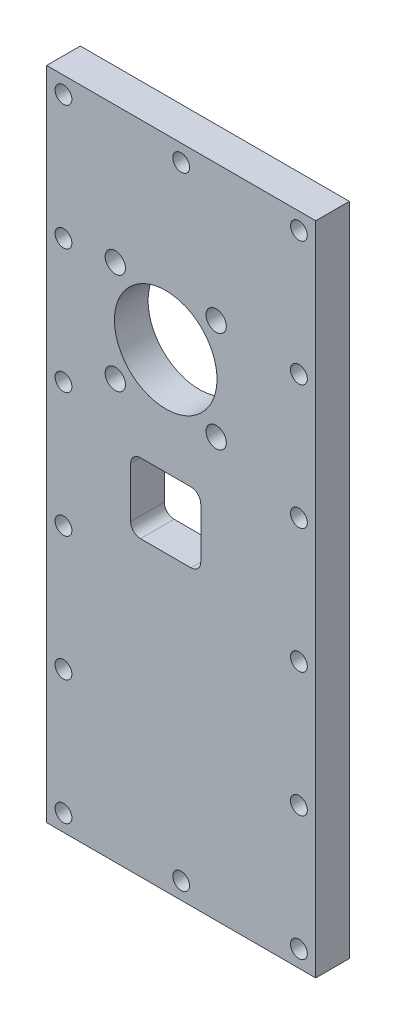
from build123d import *

# Parameters (mm, degrees)
SKIZZE1_W                       = 80
SKIZZE1_H                       = 195
AUFSATZ_LINEAR_AUSTRAGEN1_DEPTH = 10
SKIZZE2_R                       = 3.015
SKIZZE2_R_2                     = 15.25
SCHNITT_LINEAR_AUSTRAGEN1_DEPTH = 10
SKIZZE3_R                       = 1.25
SCHNITT_LINEAR_AUSTRAGEN2_DEPTH = 5
SKIZZE4_R                       = 2.5
SCHNITT_LINEAR_AUSTRAGEN3_DEPTH = 5


with BuildPart() as part:
    # Skizze1 → Aufsatz-Linear austragen1 (new body)
    with BuildSketch(Plane.XY):
        with Locations((-29.059385344, -27.400468384)):
            Rectangle(SKIZZE1_W, SKIZZE1_H)
    extrude(amount=-AUFSATZ_LINEAR_AUSTRAGEN1_DEPTH)

    # Skizze2 → Schnitt-Linear austragen1 (cut)
    with BuildSketch(Plane(origin=(0, 0, -10), x_dir=(-1, 0, 0), z_dir=(0, 0, -1))):
        with Locations((18.659385344, 29.599531616)):
            Circle(SKIZZE2_R)
        with Locations((48.659385344, 29.599531616)):
            Circle(SKIZZE2_R)
        with Locations((18.659385344, -0.400468384)):
            Circle(SKIZZE2_R)
        with Locations((48.659385344, -0.400468384)):
            Circle(SKIZZE2_R)
        with Locations((33.659385344, 14.599531616)):
            Circle(SKIZZE2_R_2)
        with BuildLine():
            Line((23.241327633, -19.900468384), (23.241327633, -34.900468384))
            ThreePointArc((23.241327633, -34.900468384), (24.096006948, -36.96384678), (26.159385344, -37.818526095))
            Line((26.159385344, -37.818526095), (41.159385344, -37.818526095))
            ThreePointArc((41.159385344, -37.818526095), (43.22276374, -36.96384678), (44.077443055, -34.900468384))
            Line((44.077443055, -34.900468384), (44.077443055, -19.900468384))
            ThreePointArc((44.077443055, -19.900468384), (43.22276374, -17.837089988), (41.159385344, -16.982410673))
            Line((41.159385344, -16.982410673), (26.159385344, -16.982410673))
            ThreePointArc((26.159385344, -16.982410673), (24.096006948, -17.837089988), (23.241327633, -19.900468384))
        make_face()
    extrude(amount=-SCHNITT_LINEAR_AUSTRAGEN1_DEPTH, mode=Mode.SUBTRACT)

    # Skizze3 → Schnitt-Linear austragen2 (cut)
    with BuildSketch(Plane(origin=(0, 0, -10), x_dir=(-1, 0, 0), z_dir=(0, 0, -1))):
        with Locations((-5.940614656, 65.099531616)):
            Circle(SKIZZE3_R)
        with Locations((63.81594416, 65.099531616)):
            Circle(SKIZZE3_R)
        with Locations((28.937664752, 65.099531616)):
            Circle(SKIZZE3_R)
        with Locations((63.81594416, 28.099531616)):
            Circle(SKIZZE3_R)
        with Locations((63.81594416, -8.900468384)):
            Circle(SKIZZE3_R)
        with Locations((63.81594416, -45.900468384)):
            Circle(SKIZZE3_R)
        with Locations((63.81594416, -82.900468384)):
            Circle(SKIZZE3_R)
        with Locations((63.81594416, -119.900468384)):
            Circle(SKIZZE3_R)
        with Locations((28.937664752, -119.900468384)):
            Circle(SKIZZE3_R)
        with Locations((-5.940614656, -119.900468384)):
            Circle(SKIZZE3_R)
        with Locations((-5.940614656, -82.900468384)):
            Circle(SKIZZE3_R)
        with Locations((-5.940614656, -45.900468384)):
            Circle(SKIZZE3_R)
        with Locations((-5.940614656, -8.900468384)):
            Circle(SKIZZE3_R)
        with Locations((-5.940614656, 28.099531616)):
            Circle(SKIZZE3_R)
    extrude(amount=-SCHNITT_LINEAR_AUSTRAGEN2_DEPTH, mode=Mode.SUBTRACT)

    # Skizze4 → Schnitt-Linear austragen3 (cut)
    with BuildSketch(Plane.XY):
        with Locations((-64.059385344, 65.099531616)):
            Circle(SKIZZE4_R)
        with Locations((5.940614656, 65.099531616)):
            Circle(SKIZZE4_R)
        with Locations((5.940614656, 28.099531616)):
            Circle(SKIZZE4_R)
        with Locations((5.940614656, -8.900468384)):
            Circle(SKIZZE4_R)
        with Locations((5.940614656, -45.900468384)):
            Circle(SKIZZE4_R)
        with Locations((5.940614656, -82.900468384)):
            Circle(SKIZZE4_R)
        with Locations((5.940614656, -119.900468384)):
            Circle(SKIZZE4_R)
        with Locations((-64.059385344, -119.900468384)):
            Circle(SKIZZE4_R)
        with Locations((-64.059385344, -82.900468384)):
            Circle(SKIZZE4_R)
        with Locations((-64.059385344, -45.900468384)):
            Circle(SKIZZE4_R)
        with Locations((-64.059385344, -8.900468384)):
            Circle(SKIZZE4_R)
        with Locations((-64.059385344, 28.099531616)):
            Circle(SKIZZE4_R)
        with Locations((-29.059385344, -119.900468384)):
            Circle(SKIZZE4_R)
        with Locations((-29.059385344, 65.099531616)):
            Circle(SKIZZE4_R)
    extrude(amount=-SCHNITT_LINEAR_AUSTRAGEN3_DEPTH, mode=Mode.SUBTRACT)


solid = part.part
